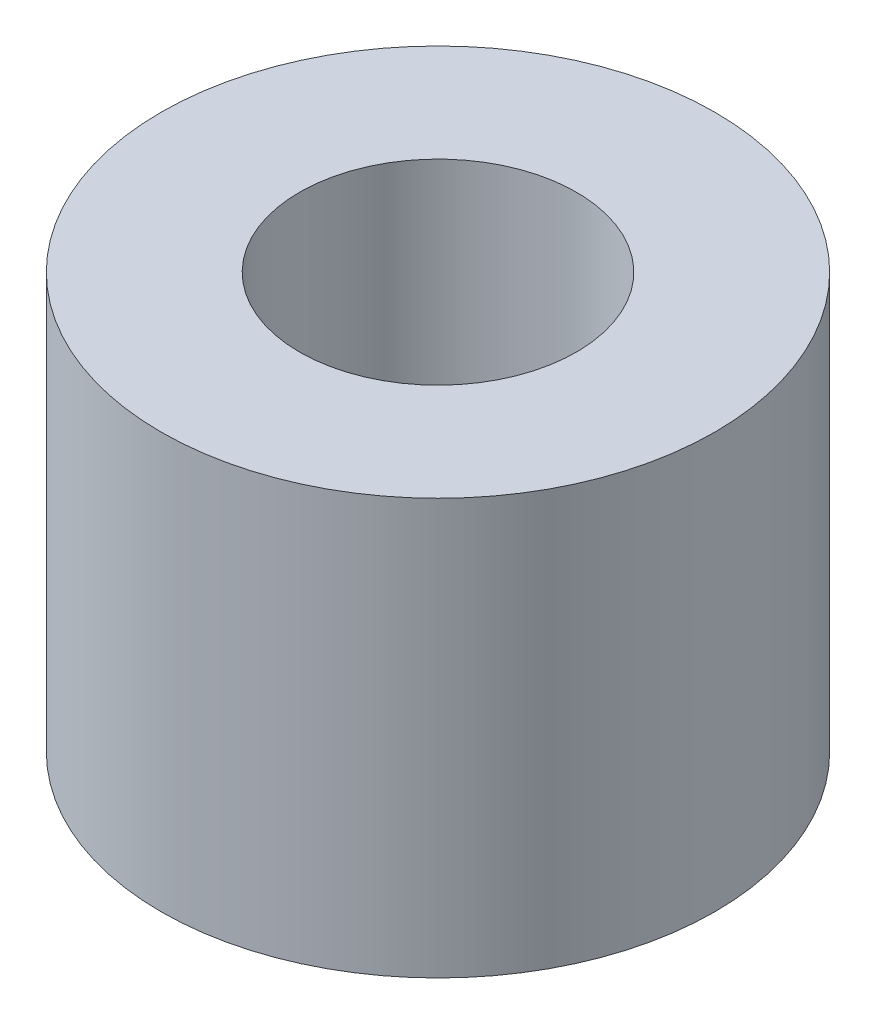
from build123d import *

# Parameters (mm, degrees)
SKETCH_1_R      = 6
SKETCH_1_R_2    = 3
EXTRUDE_1_DEPTH = 9


with BuildPart() as part:
    # 스케치1 → 보스-돌출1 (new body)
    with BuildSketch(Plane(origin=(0, 0, 0), x_dir=(1, 0, 0), z_dir=(0, 1, 0))):
        Circle(SKETCH_1_R)
        Circle(SKETCH_1_R_2, mode=Mode.SUBTRACT)
    extrude(amount=EXTRUDE_1_DEPTH)


solid = part.part
